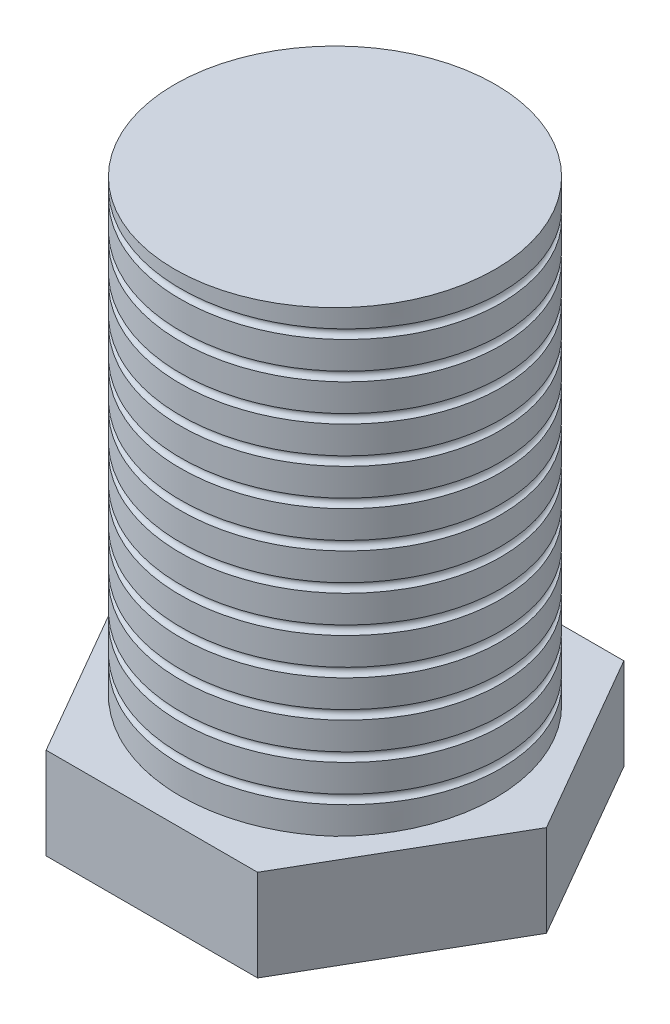
from build123d import *

# Parameters (mm, degrees)
SKETCH2_R              = 3.5
BOSS_EXTRUDE2_DEPTH    = 10
CUT_SWEEP2_PITCH       = 0.8
CUT_SWEEP2_HEIGHT      = 10
CUT_SWEEP2_RADIUS      = 0.35
CUT_SWEEP2_START_ANGLE = 90
SKETCH9_R              = 0.1
BOSS_EXTRUDE3_DEPTH    = 2


with BuildPart() as part:
    # Sketch2 → Boss-Extrude2 (new body)
    with BuildSketch(Plane(origin=(0, 0, 0), x_dir=(1, 0, 0), z_dir=(0, 1, 0))):
        Circle(SKETCH2_R)
    extrude(amount=BOSS_EXTRUDE2_DEPTH)

    # Cut-Sweep2: sweep along a helix
    with BuildLine() as cut_sweep2_path:
        add(Helix(CUT_SWEEP2_PITCH, CUT_SWEEP2_HEIGHT, CUT_SWEEP2_RADIUS, center=(0, 0, 0), direction=(0, 1, 0), lefthand=True, mode=Mode.PRIVATE).rotate(Axis((0, 0, 0), (0, 1, 0)), CUT_SWEEP2_START_ANGLE))
    # Sketch9 → Cut-Sweep2 (sweep, cut)
    with BuildSketch(Plane(origin=(0, 0, 0), x_dir=(0, 0, -1), z_dir=(1, 0, 0))):
        with Locations((-3.5, 0)):
            Circle(SKETCH9_R)
    sweep(path=cut_sweep2_path.line, is_frenet=True, mode=Mode.SUBTRACT)

    # Sketch10 → Boss-Extrude3 (add)
    with BuildSketch(Plane.XZ):
        Polygon((-4.618802154, 0), (-2.309401077, -4), (2.309401077, -4), (4.618802154, 0), (2.309401077, 4), (-2.309401077, 4), align=None)
    extrude(amount=BOSS_EXTRUDE3_DEPTH)


solid = part.part
